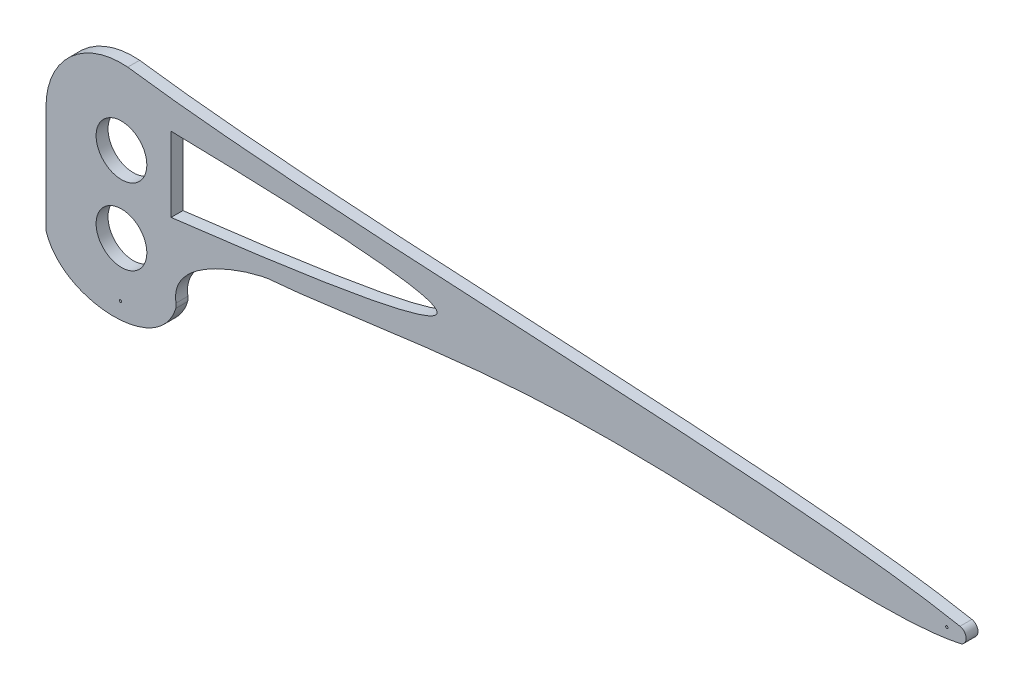
from build123d import *

# Parameters (mm, degrees)
SKETCH1_R               = 8.466666667
BOSS_EXTRUDE1_DEPTH     = 3.96875
SCALE1_SCALE            = 0.75
CUT_EXTRUDE1_DEPTH      = 234.969384422
CUT_EXTRUDE1_DEPTH_BACK = 234.969384422
CUT_EXTRUDE2_DEPTH      = 234.969384422
CUT_EXTRUDE2_DEPTH_BACK = 234.969384422
SKETCH3_R               = 0.28575


with BuildPart() as part:
    # Sketch1 → Boss-Extrude1 (new body)
    with BuildSketch(Plane.XY):
        with BuildLine():
            ThreePointArc((2.090204907, 25.105012471), (-17.058347301, 18.537621075), (-25.191875828, 0))
            Line((-25.191875828, 0), (-25.191875828, -35.215356132))
            ThreePointArc((-25.191875828, -35.215356132), (-25.144594979, -35.781140778), (-25.004063999, -36.331230578))
            add(Edge.make_bspline(
                [(-25.004063999, -36.331230578), (-24.302161584, -38.357321078), (-17.500345693, -49.472928078), (6.486565439, -52.353017034), (16.828257208, -40.890808587), (18.117618202, -36.640731795)],
                knots=[0.011286064, 0.011286064, 0.011286064, 0.011286064, 0.130987572, 0.750185474, 0.983991621, 0.983991621, 0.983991621, 0.983991621], degree=3))
            ThreePointArc((18.117618202, -36.640731795), (18.258374718, -35.854153527), (18.212152653, -35.056418427))
            add(Edge.make_bspline(
                [(18.212152653, -35.056418427), (15.722327617, -21.003254002), (45.083704914, -12.577387864), (50.314621311, -12.487786805)],
                knots=[0.243688719, 0.243688719, 0.243688719, 0.243688719, 1, 1, 1, 1], degree=3))
            add(Edge.make_bspline(
                [(50.314621311, -12.487786805), (67.828969762, -11.217353563), (162.851239243, 6.097445829), (250.038282618, -9.041784468), (279.934807735, -2.602592093)],
                knots=[0.23584572, 0.23584572, 0.23584572, 0.23584572, 0.495200792, 0.941477437, 0.941477437, 0.941477437, 0.941477437], degree=3))
            ThreePointArc((279.934807735, -2.602592093), (281.939894054, -0.09633433), (279.889362488, 2.372880002))
            add(Edge.make_bspline(
                [(2.090204907, 25.105012471), (29.372633882, 21.318909318), (128.041674084, 14.540572725), (239.548411309, 10.293455518), (279.889362488, 2.372880002)],
                knots=[0.008543469, 0.008543469, 0.008543469, 0.008543469, 0.340594684, 0.94139515, 0.94139515, 0.94139515, 0.94139515], degree=3))
        make_face()
        with Locations((0, -25.4)):
            Circle(SKETCH1_R, mode=Mode.SUBTRACT)
        Circle(SKETCH1_R, mode=Mode.SUBTRACT)
    extrude(amount=BOSS_EXTRUDE1_DEPTH)


with BuildPart() as part_1:
    # Scale1: scaled about (77.999855218, -1.358061802, 1.984375)
    add(part.part.scale(SCALE1_SCALE).moved(Location((19.499963804, -0.33951545, 0.49609375))))

    # Sketch2 → Cut-Extrude1 (cut, two sides: drawn at the far end of the back side and taken through both)
    with BuildSketch(Plane.XY.offset(3.472656424).offset(-CUT_EXTRUDE1_DEPTH_BACK)):
        with BuildLine():
            Line((31.923276194, -8.669949019), (31.923276194, 10.020002836))
            add(Edge.make_bspline(
                [(31.923276194, 10.020002836), (165.110282537, 7.314969964), (31.923276194, -8.669949019)],
                knots=[0, 0, 0, 1, 1, 1], degree=2))
        make_face()
    extrude(amount=CUT_EXTRUDE1_DEPTH + CUT_EXTRUDE1_DEPTH_BACK, mode=Mode.SUBTRACT)

    # Sketch3 → Cut-Extrude2 (cut, two sides: drawn at the far end of the back side and taken through both)
    with BuildSketch(Plane.XY.offset(3.472656424).offset(-CUT_EXTRUDE2_DEPTH_BACK)):
        with Locations((19.266230894, -33.149528109)):
            Circle(SKETCH3_R)
        with Locations((226.12693778, -0.374743535)):
            Circle(SKETCH3_R)
    extrude(amount=CUT_EXTRUDE2_DEPTH + CUT_EXTRUDE2_DEPTH_BACK, mode=Mode.SUBTRACT)


solid = part_1.part
